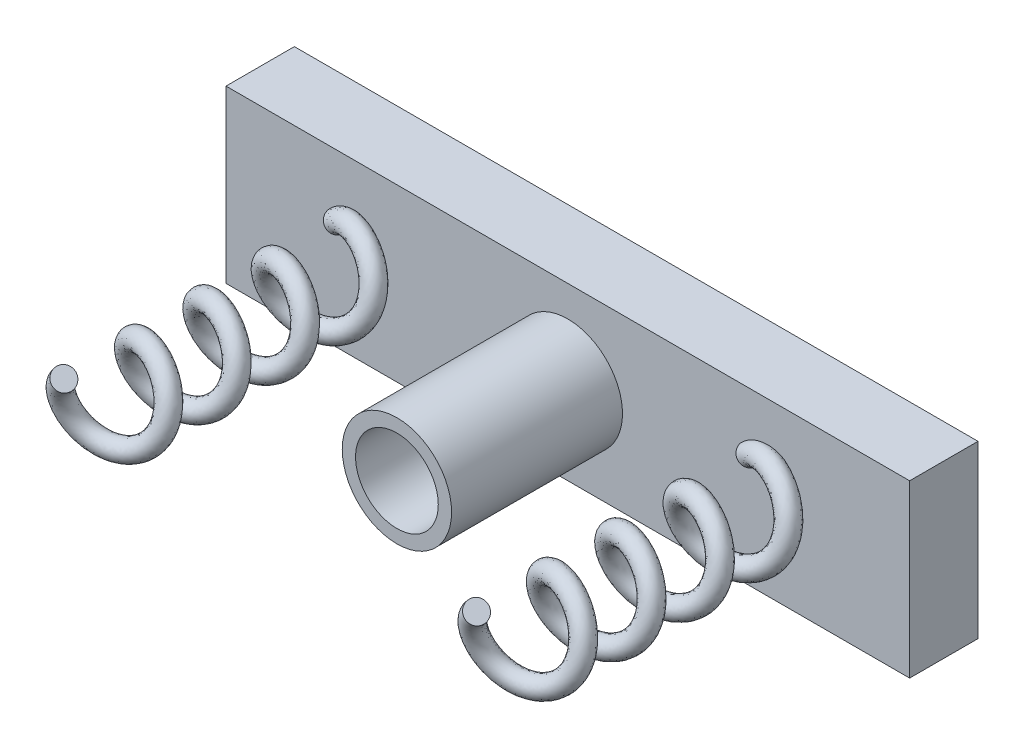
from build123d import *

# Parameters (mm, degrees)
SKETCH_1_W          = 100
SKETCH_1_H          = 25
EXTRUDE_1_DEPTH     = 10
SWEEP_2_PITCH       = 10
SWEEP_3_PITCH       = 10
SKETCH_21_R         = 7.997631685
EXTRUDE_2_DEPTH     = 25
SKETCH_22_R         = 6.05
CUT_EXTRUDE_1_DEPTH = 40


with BuildPart() as part:
    # 草图1 → 凸台-拉伸1 (new body)
    with BuildSketch(Plane.XY):
        Rectangle(SKETCH_1_W, SKETCH_1_H)
    extrude(amount=EXTRUDE_1_DEPTH)

    # 扫描2: arcs per turn and ends read off the stored shape
    # 扫描2: the profile of 草图17 screwed along a left-hand helix through 4 turns, 16 arcs to a turn; built about Z, then put on its axis
    sweep_2_z = Axis((0, 0, 0), (0, 0, 1))
    sweep_2_corners = [(5.143794621, -0.434706368, -1.365670331), (6.643794621, 0.020265339, 0.06366544), (5.143794621, 0.475237046, 1.493001211), (3.643794621, 0.020265339, 0.06366544)]
    with BuildLine(mode=Mode.PRIVATE) as sweep_2_profile:
        ThreePointArc((5.143794621, -0.434706368, -1.365670331), (6.204454792, -0.30144824, -0.947027576), (6.643794621, 0.020265339, 0.06366544))
        ThreePointArc((6.643794621, 0.020265339, 0.06366544), (6.204454792, 0.341978918, 1.074358457), (5.143794621, 0.475237046, 1.493001211))
        ThreePointArc((5.143794621, 0.475237046, 1.493001211), (4.083134449, 0.341978918, 1.074358457), (3.643794621, 0.020265339, 0.06366544))
        ThreePointArc((3.643794621, 0.020265339, 0.06366544), (4.083134449, -0.30144824, -0.947027576), (5.143794621, -0.434706368, -1.365670331))
    sweep_2_cap = Face(sweep_2_profile.wire())
    sweep_2_arcs = [((5.143794621, -0.434706368, -1.365670331), (6.643794621, -0.434706368, -1.365670331), (6.643794621, 0.020265339, 0.06366544), (1, 0.7071067811865475, 1)), ((6.643794621, 0.020265339, 0.06366544), (6.643794621, 0.475237046, 1.493001211), (5.143794621, 0.475237046, 1.493001211), (1, 0.7071067811865475, 1)), ((5.143794621, 0.475237046, 1.493001211), (3.643794621, 0.475237046, 1.493001211), (3.643794621, 0.020265339, 0.06366544), (1, 0.7071067811865475, 1)), ((3.643794621, 0.020265339, 0.06366544), (3.643794621, -0.434706368, -1.365670331), (5.143794621, -0.434706368, -1.365670331), (1, 0.7071067811865475, 1))]  # start, shoulder, end, weights
    sweep_2_turn_angles = [0, -11.25, -22.5, -33.75, -45, -56.25, -67.5, -78.75, -90, -101.25, -112.5, -123.75, -135, -146.25, -157.5, -168.75, -180, -191.25, -202.5, -213.75, -225, -236.25, -247.5, -258.75, -270, -281.25, -292.5, -303.75, -315, -326.25, -337.5, -348.75, -360]
    sweep_2_turn_weights = [1, 0.9807852804032304, 1, 0.9807852804032304, 1, 0.9807852804032304, 1, 0.9807852804032304, 1, 0.9807852804032304, 1, 0.9807852804032304, 1, 0.9807852804032304, 1, 0.9807852804032304, 1, 0.9807852804032304, 1, 0.9807852804032304, 1, 0.9807852804032304, 1, 0.9807852804032304, 1, 0.9807852804032304, 1, 0.9807852804032304, 1, 0.9807852804032304, 1, 0.9807852804032304, 1]
    sweep_2_turn_sides = [Face.make_bezier_surface([[Vector(p[j][0], p[j][1], 0).rotate(sweep_2_z, sweep_2_turn_angles[2 * i + k]) / sweep_2_turn_weights[2 * i + k] + Vector(0, 0, p[j][2] + -SWEEP_2_PITCH * sweep_2_turn_angles[2 * i + k] / 360) for k in range(3)] for j in range(3)], [[p[3][j] * sweep_2_turn_weights[2 * i + k] for k in range(3)] for j in range(3)]) for p in sweep_2_arcs for i in range(16)]
    sweep_2 = Plane(origin=(-30, 0, 10), x_dir=(-0.7071067811865509, 0.7071067811865441, 0), z_dir=(0, 0, 1)) * Solid(Shell([*[p.moved(Location((0, 0, SWEEP_2_PITCH * i))) for i in range(4) for p in sweep_2_turn_sides], sweep_2_cap, sweep_2_cap.rotate(sweep_2_z, -1440).moved(Location((0, 0, -SWEEP_2_PITCH * -1440 / 360)))]))
    add(sweep_2)

    # 扫描3: arcs per turn and ends read off the stored shape
    # 扫描3: the profile of 草图20 screwed along a left-hand helix through 4 turns, 16 arcs to a turn; built about Z, then put on its axis
    sweep_3_z = Axis((0, 0, 0), (0, 0, 1))
    sweep_3_corners = [(5.371241581, -0.570859454, -1.793407867), (6.871241581, -0.115887747, -0.364072096), (5.371241581, 0.339083959, 1.065263675), (3.871241581, -0.115887747, -0.364072096)]
    with BuildLine(mode=Mode.PRIVATE) as sweep_3_profile:
        ThreePointArc((5.371241581, -0.570859454, -1.793407867), (6.431901753, -0.437601326, -1.374765112), (6.871241581, -0.115887747, -0.364072096))
        ThreePointArc((6.871241581, -0.115887747, -0.364072096), (6.431901753, 0.205825832, 0.646620921), (5.371241581, 0.339083959, 1.065263675))
        ThreePointArc((5.371241581, 0.339083959, 1.065263675), (4.31058141, 0.205825832, 0.646620921), (3.871241581, -0.115887747, -0.364072096))
        ThreePointArc((3.871241581, -0.115887747, -0.364072096), (4.31058141, -0.437601326, -1.374765112), (5.371241581, -0.570859454, -1.793407867))
    sweep_3_cap = Face(sweep_3_profile.wire())
    sweep_3_arcs = [((5.371241581, -0.570859454, -1.793407867), (6.871241581, -0.570859454, -1.793407867), (6.871241581, -0.115887747, -0.364072096), (1, 0.7071067811865475, 1)), ((6.871241581, -0.115887747, -0.364072096), (6.871241581, 0.339083959, 1.065263675), (5.371241581, 0.339083959, 1.065263675), (1, 0.7071067811865475, 1)), ((5.371241581, 0.339083959, 1.065263675), (3.871241581, 0.339083959, 1.065263675), (3.871241581, -0.115887747, -0.364072096), (1, 0.7071067811865475, 1)), ((3.871241581, -0.115887747, -0.364072096), (3.871241581, -0.570859454, -1.793407867), (5.371241581, -0.570859454, -1.793407867), (1, 0.7071067811865475, 1))]  # start, shoulder, end, weights
    sweep_3_turn_angles = [0, -11.25, -22.5, -33.75, -45, -56.25, -67.5, -78.75, -90, -101.25, -112.5, -123.75, -135, -146.25, -157.5, -168.75, -180, -191.25, -202.5, -213.75, -225, -236.25, -247.5, -258.75, -270, -281.25, -292.5, -303.75, -315, -326.25, -337.5, -348.75, -360]
    sweep_3_turn_weights = [1, 0.9807852804032304, 1, 0.9807852804032304, 1, 0.9807852804032304, 1, 0.9807852804032304, 1, 0.9807852804032304, 1, 0.9807852804032304, 1, 0.9807852804032304, 1, 0.9807852804032304, 1, 0.9807852804032304, 1, 0.9807852804032304, 1, 0.9807852804032304, 1, 0.9807852804032304, 1, 0.9807852804032304, 1, 0.9807852804032304, 1, 0.9807852804032304, 1, 0.9807852804032304, 1]
    sweep_3_turn_sides = [Face.make_bezier_surface([[Vector(p[j][0], p[j][1], 0).rotate(sweep_3_z, sweep_3_turn_angles[2 * i + k]) / sweep_3_turn_weights[2 * i + k] + Vector(0, 0, p[j][2] + -SWEEP_3_PITCH * sweep_3_turn_angles[2 * i + k] / 360) for k in range(3)] for j in range(3)], [[p[3][j] * sweep_3_turn_weights[2 * i + k] for k in range(3)] for j in range(3)]) for p in sweep_3_arcs for i in range(16)]
    sweep_3 = Plane(origin=(30, 0, 10), x_dir=(-0.7071067811865511, 0.707106781186544, 0), z_dir=(0, 0, 1)) * Solid(Shell([*[p.moved(Location((0, 0, SWEEP_3_PITCH * i))) for i in range(4) for p in sweep_3_turn_sides], sweep_3_cap, sweep_3_cap.rotate(sweep_3_z, -1440).moved(Location((0, 0, -SWEEP_3_PITCH * -1440 / 360)))]))
    add(sweep_3)

    # 草图21 → 凸台-拉伸2 (add)
    with BuildSketch(Plane.XY.offset(10)):
        with Locations(Location((0, 0, 0), (0, 0, 180))):
            Circle(SKETCH_21_R)
    extrude(amount=EXTRUDE_2_DEPTH)

    # 草图22 → 切除-拉伸1 (cut)
    with BuildSketch(Plane.XY.offset(35)):
        Circle(SKETCH_22_R)
    extrude(amount=-CUT_EXTRUDE_1_DEPTH, mode=Mode.SUBTRACT)


solid = part.part
